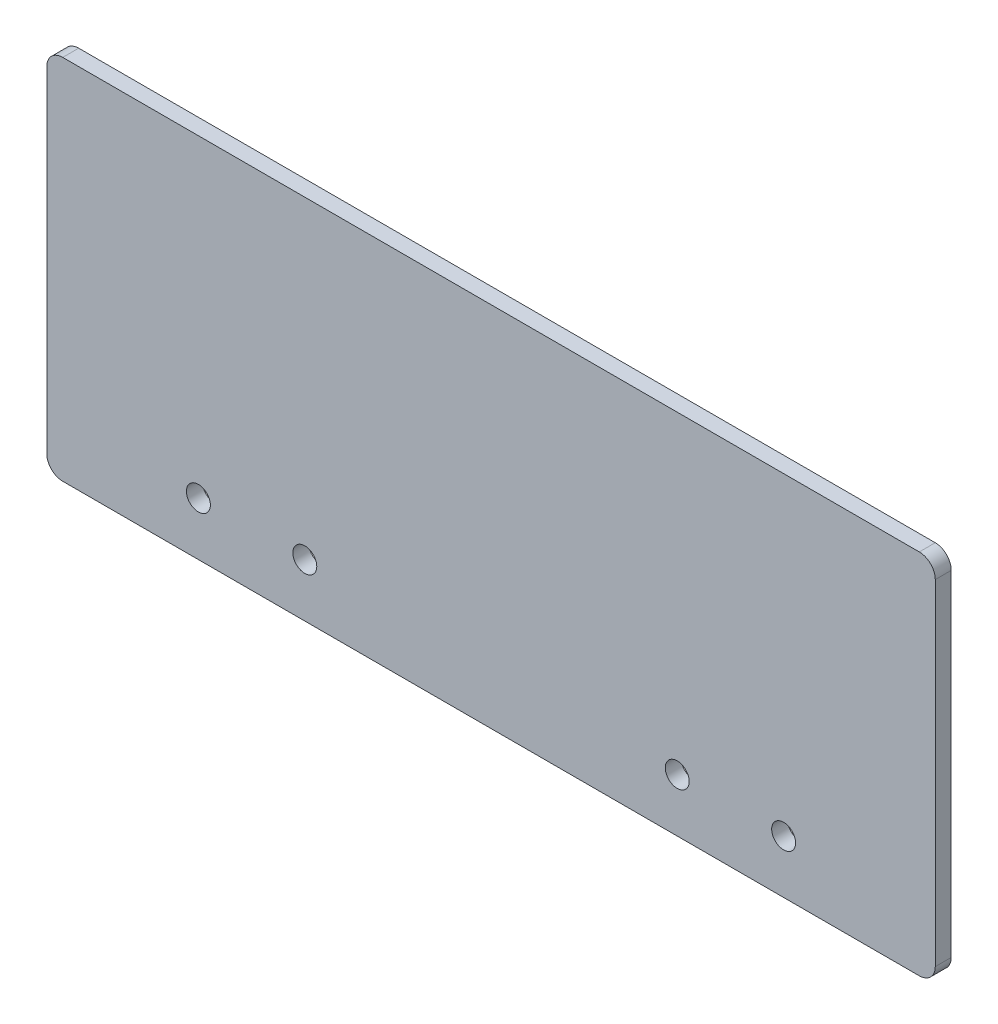
from build123d import *

# Parameters (mm, degrees)
ESQUISSE1_W                  = 167
ESQUISSE1_H                  = 69
BOSS_EXTRU_1_DEPTH           = 3
CONG_1_R                     = 3
ENL_V_MAT_EXTRU_1_DEPTH      = 181.718012384
ENL_V_MAT_EXTRU_1_DEPTH_BACK = 181.718012384
ESQUISSE2_R                  = 2.25


with BuildPart() as part:
    # Esquisse1 → Boss.-Extru.1 (new body)
    with BuildSketch(Plane.XY):
        with Locations((83.5, 34.5)):
            Rectangle(ESQUISSE1_W, ESQUISSE1_H)
    extrude(amount=BOSS_EXTRU_1_DEPTH)

    # Congé1
    cong_1_edges = [part.edges().sort_by_distance(p)[0] for p in [
        (167, 0, 1.5),
        (167, 69, 1.5),
        (0, 69, 1.5),
        (0, 0, 1.5),
    ]]
    fillet(cong_1_edges, radius=CONG_1_R)

    # Esquisse2 → Enlèv. mat.-Extru.1 (cut, two sides: drawn at the far end of the back side and taken through both)
    with BuildSketch(Plane.XY.offset(3).offset(-ENL_V_MAT_EXTRU_1_DEPTH_BACK)):
        with Locations((28.5, 10)):
            Circle(ESQUISSE2_R)
        with Locations((48.5, 10)):
            Circle(ESQUISSE2_R)
        with Locations((118.5, 10)):
            Circle(ESQUISSE2_R)
        with Locations((138.5, 10)):
            Circle(ESQUISSE2_R)
    extrude(amount=ENL_V_MAT_EXTRU_1_DEPTH + ENL_V_MAT_EXTRU_1_DEPTH_BACK, mode=Mode.SUBTRACT)


solid = part.part
